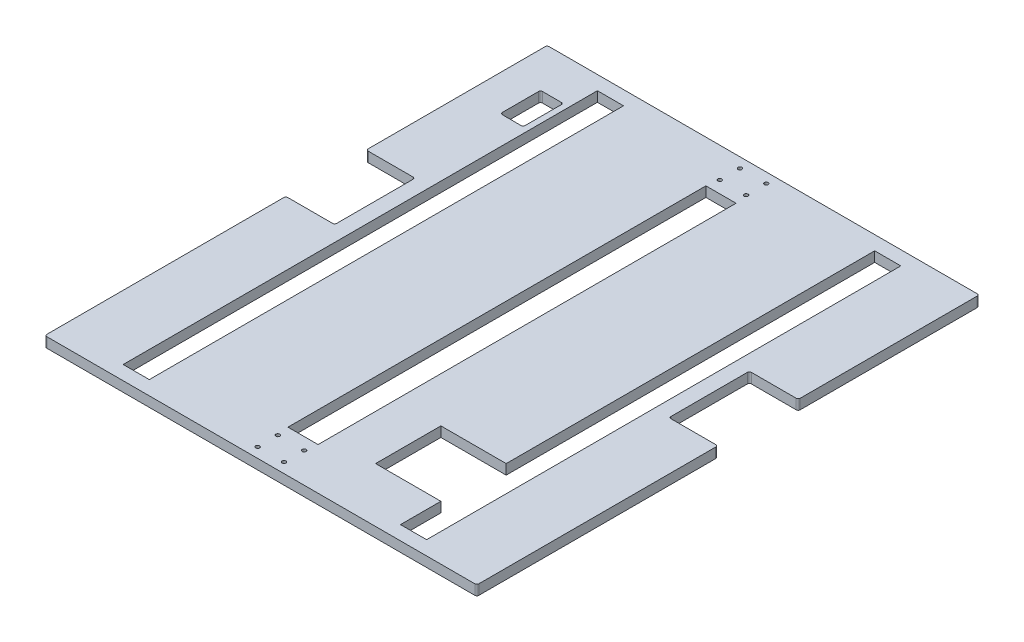
from build123d import *

# Parameters (mm, degrees)
SKETCH1_W           = 430
SKETCH1_H           = 500
BOSS_EXTRUDE1_DEPTH = 10
SKETCH2_W           = 48.6
SKETCH2_H           = 80
CUT_EXTRUDE1_DEPTH  = 10
SKETCH3_R           = 1.9
SKETCH3_W           = 26
SKETCH3_H           = 472
SKETCH3_W_2         = 22.64710068
SKETCH3_H_2         = 40
SKETCH3_W_3         = 30
SKETCH3_H_3         = 416
CUT_EXTRUDE2_DEPTH  = 10
SKETCH4_W           = 65
SKETCH4_H           = 65
CUT_EXTRUDE3_DEPTH  = 10
FILLET2_R           = 2


with BuildPart() as part:
    # Sketch1 → Boss-Extrude1 (new body)
    with BuildSketch(Plane(origin=(0, 0, 0), x_dir=(1, 0, 0), z_dir=(0, 1, 0))):
        with Locations((6126.084066999, -8702.312377786)):
            Rectangle(SKETCH1_W, SKETCH1_H)
    extrude(amount=BOSS_EXTRUDE1_DEPTH)

    # Sketch2 → Cut-Extrude1 (cut)
    with BuildSketch(Plane(origin=(0, 10, 0), x_dir=(1, 0, 0), z_dir=(0, 1, 0))):
        with Locations((5935.384066999, -8672.447976714)):
            Rectangle(SKETCH2_W, SKETCH2_H)
        with Locations((6316.784066999, -8672.447976714)):
            Rectangle(SKETCH2_W, SKETCH2_H)
    extrude(amount=-CUT_EXTRUDE1_DEPTH, mode=Mode.SUBTRACT)

    # Sketch3 → Cut-Extrude2 (cut)
    with BuildSketch(Plane(origin=(0, 10, 0), x_dir=(1, 0, 0), z_dir=(0, 1, 0))):
        with Locations((6112.984066999, -8942.312377786)):
            Circle(SKETCH3_R)
        with Locations((6139.184066999, -8942.312377786)):
            Circle(SKETCH3_R)
        with Locations((6112.984066999, -8462.312377786)):
            Circle(SKETCH3_R)
        with Locations((6139.184066999, -8462.312377786)):
            Circle(SKETCH3_R)
        with Locations((6112.984066999, -8922.312377786)):
            Circle(SKETCH3_R)
        with Locations((6139.184066999, -8922.312377786)):
            Circle(SKETCH3_R)
        with Locations((6112.984066999, -8482.312377786)):
            Circle(SKETCH3_R)
        with Locations((6139.184066999, -8482.312377786)):
            Circle(SKETCH3_R)
        Polygon((5975.084066999, -8541.651929061), (5975.084066999, -8938.312377786), (6001.084066999, -8938.312377786), (6001.084066999, -8466.312377786), (5975.084066999, -8466.312377786), align=None)
        with Locations((6264.084066999, -8702.312377786)):
            Rectangle(SKETCH3_W, SKETCH3_H)
        with Locations((5957.807617339, -8514.312377786)):
            Rectangle(SKETCH3_W_2, SKETCH3_H_2)
        with Locations((6126.084066999, -8702.312377786)):
            Rectangle(SKETCH3_W_3, SKETCH3_H_3)
    extrude(amount=-CUT_EXTRUDE2_DEPTH, mode=Mode.SUBTRACT)

    # Sketch4 → Cut-Extrude3 (cut)
    with BuildSketch(Plane(origin=(0, 10, 0), x_dir=(1, 0, 0), z_dir=(0, 1, 0))):
        with Locations((6218.584066999, -8865.596518708)):
            Rectangle(SKETCH4_W, SKETCH4_H)
    extrude(amount=-CUT_EXTRUDE3_DEPTH, mode=Mode.SUBTRACT)

    # Fillet2
    fillet2_edges = [part.edges().sort_by_distance(p)[0] for p in [
        (5969.131167679, 5, 8494.312377786),
        (5969.131167679, 5, 8534.312377786),
        (5946.484066999, 5, 8534.312377786),
        (5946.484066999, 5, 8494.312377786),
        (6292.484066999, 5, 8632.447976714),
        (6341.084066999, 5, 8632.447976714),
        (6341.084066999, 5, 8712.447976714),
        (6292.484066999, 5, 8712.447976714),
        (5959.684066999, 5, 8632.447976714),
        (5959.684066999, 5, 8712.447976714),
        (5911.084066999, 5, 8712.447976714),
        (5911.084066999, 5, 8632.447976714),
        (5911.084066999, 5, 8452.312377786),
        (6341.084066999, 5, 8452.312377786),
        (6341.084066999, 5, 8952.312377786),
        (5911.084066999, 5, 8952.312377786),
    ]]
    fillet(fillet2_edges, radius=FILLET2_R)


solid = part.part
